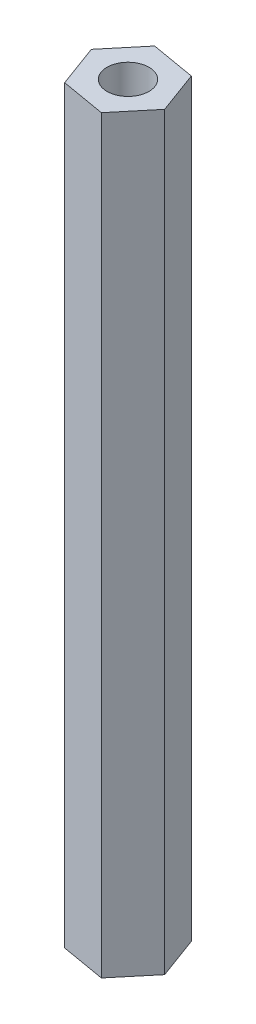
from build123d import *

# Parameters (mm, degrees)
SKETCH1_R           = 1.4
BOSS_EXTRUDE1_DEPTH = 50


with BuildPart() as part:
    # Sketch1 → Boss-Extrude1 (new body)
    with BuildSketch(Plane(origin=(0, 0, 0), x_dir=(1, 0, 0), z_dir=(0, 1, 0))):
        Polygon((1.03732279, -2.814953184), (2.956482363, -0.509128705), (1.919159573, 2.30582448), (-1.03732279, 2.814953184), (-2.956482363, 0.509128704), (-1.919159573, -2.30582448), align=None)
        Circle(SKETCH1_R, mode=Mode.SUBTRACT)
    extrude(amount=BOSS_EXTRUDE1_DEPTH)


solid = part.part
